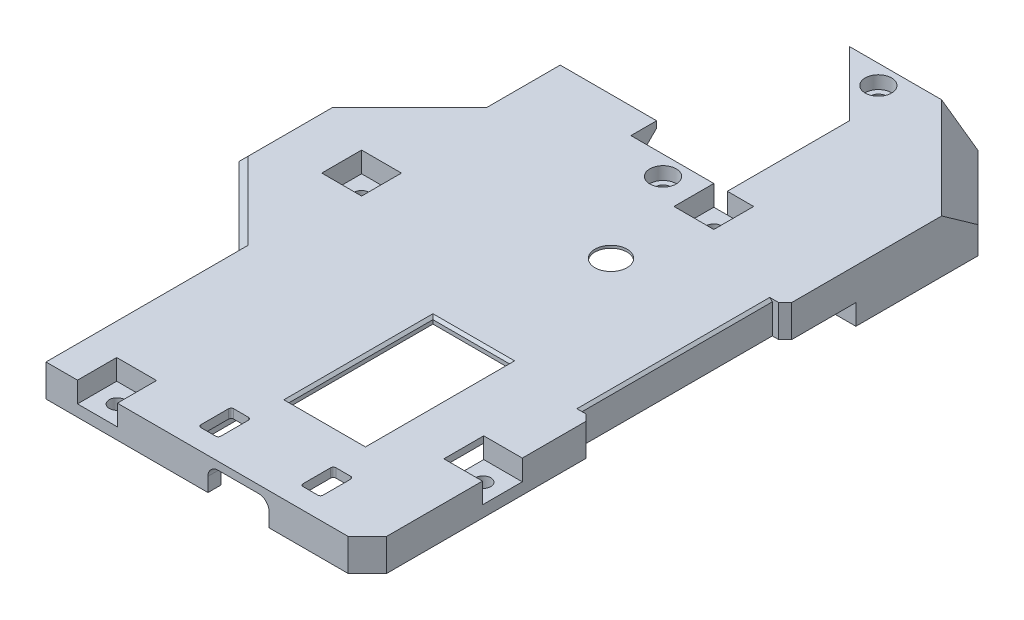
from build123d import *

# Parameters (mm, degrees)
EXTRUDE_1_DEPTH          = 5
CUT_EXTRUDE_1_DEPTH      = 117.404467268
CUT_EXTRUDE_1_DEPTH_BACK = 117.404467268
EXTRUDE_2_DEPTH          = 2
EXTRUDE_3_DEPTH          = 3
CHAMFER_1_SIZE           = 3
CHAMFER_2_SIZE           = 4
EXTRUDE_4_DEPTH          = 5
CHAMFER_3_SIZE           = 4
SKETCH_6_R               = 2.05
CUT_EXTRUDE_2_DEPTH      = 2
SKETCH_7_R               = 1.2
CUT_EXTRUDE_3_DEPTH      = 3
CHAMFER_4_SIZE           = 1
CHAMFER_5_SIZE           = 3
SKETCH_8_W               = 2
SKETCH_8_H               = 30
CUT_EXTRUDE_4_DEPTH      = 117.404467268
SKETCH_9_W               = 28.1
SKETCH_9_H               = 63.9
CUT_EXTRUDE_5_DEPTH      = 0.6
CUT_EXTRUDE_6_DEPTH      = 3.4
CUT_EXTRUDE_7_REACH      = 118.404
SKETCH_12_W              = 20.3
SKETCH_12_H              = 20.1
CUT_EXTRUDE_8_DEPTH      = 0.6
SKETCH_13_W              = 11.9
SKETCH_13_H              = 22.4
CUT_EXTRUDE_9_DEPTH      = 1
SKETCH_14_R              = 2.5
CUT_EXTRUDE_10_DEPTH     = 117.387971887
CHAMFER_6_SIZE           = 0.4
SKETCH_15_W              = 20.3
SKETCH_15_H              = 2
CUT_EXTRUDE_11_DEPTH     = 4.6
SKETCH_16_W              = 6.2
SKETCH_16_H              = 6.1
SKETCH_16_W_2            = 6
SKETCH_16_H_2            = 6.2
CUT_EXTRUDE_12_DEPTH     = 3.2
SKETCH_17_R              = 1.2
CUT_EXTRUDE_13_DEPTH     = 117.341050365
SKETCH_18_R              = 1.2
CUT_EXTRUDE_14_DEPTH     = 117.404467268
SKETCH_19_R              = 2.05
CUT_EXTRUDE_15_DEPTH     = 2
EXTRUDE_5_DEPTH          = 15
CHAMFER_8_SIZE           = 1
EXTRUDE_6_DEPTH          = 1.2
CHAMFER_9_SIZE           = 1.2
FILLET_START             = -55.913222165
FILLET_2_DEPTH           = 11.82644433
FILLET_2_2_ANGLE         = 180
FILLET_2_3_ANGLE         = 180
SKETCH_23_W              = 3.9
SKETCH_23_H              = 22
CUT_EXTRUDE_16_DEPTH     = 3
CHAMFER_10_SIZE          = 3
CUT_EXTRUDE_17_REACH     = 118.404
SKETCH_24_W              = 3.1
SKETCH_24_H              = 5.1
SKETCH_25_W              = 5.5
SKETCH_25_H              = 7.5
SKETCH_25_W_2            = 3.1
SKETCH_25_H_2            = 5.1
EXTRUDE_7_DEPTH          = 0.4
FILLET_3_R               = 0.4
EXTRUDE_8_DEPTH          = 3.2
CUT_EXTRUDE_18_DEPTH     = 2.2
CUT_EXTRUDE_19_DEPTH     = 0.4
CUT_EXTRUDE_20_DEPTH     = 0.4
FILLET_4_R               = 0.4
CHAMFER_11_SIZE          = 0.4


with BuildPart() as part:
    # 草图1 → 凸台-拉伸1 (new body)
    with BuildSketch(Plane(origin=(0, 0, 0), x_dir=(1, 0, 0), z_dir=(0, 1, 0))):
        Polygon((40, 105), (50, 95), (50, 0), (0, 0), (0, 105), align=None)
    extrude(amount=EXTRUDE_1_DEPTH)

    # 草图2 → 切除-拉伸1 (cut, two sides: drawn at the far end of the back side and taken through both)
    with BuildSketch(Plane(origin=(0, 5, 0), x_dir=(1, 0, 0), z_dir=(0, 1, 0)).offset(-CUT_EXTRUDE_1_DEPTH_BACK)):
        Polygon((0, 105), (20, 105), (30, 95), (30, 76), (0, 76), align=None)
    extrude(amount=CUT_EXTRUDE_1_DEPTH + CUT_EXTRUDE_1_DEPTH_BACK, mode=Mode.SUBTRACT)

    # 草图3 → 凸台-拉伸2 (add)
    with BuildSketch(Plane(origin=(0, 5, 0), x_dir=(1, 0, 0), z_dir=(0, 1, 0))):
        Polygon((0, 70), (0, 30), (-13, 43), (-13, 57), align=None)
    extrude(amount=-EXTRUDE_2_DEPTH)

    # 草图4 → 凸台-拉伸3 (add)
    with BuildSketch(Plane.XZ.offset(-3)):
        Polygon((0, -70), (-4, -66), (-4, -34), (0, -30), align=None)
    extrude(amount=EXTRUDE_3_DEPTH)

    # 倒角1
    chamfer_1_edges = [part.edges().sort_by_distance(p)[0] for p in [
        (-4, 3, -50),
    ]]
    chamfer(chamfer_1_edges, length=CHAMFER_1_SIZE - 0.0001)  # a hair under: the kernel refuses the full size

    # 倒角2
    chamfer_2_edges = [part.edges().sort_by_distance(p)[0] for p in [
        (45, 5, -100),
    ]]
    chamfer(chamfer_2_edges, length=CHAMFER_2_SIZE)

    # 草图5 → 凸台-拉伸4 (add)
    with BuildSketch(Plane(origin=(0, 5, 0), x_dir=(1, 0, 0), z_dir=(0, 1, 0))):
        Polygon((0, 0), (-4, 4), (-4, 16), (0, 20), align=None)
    extrude(amount=-EXTRUDE_4_DEPTH)

    # 倒角3
    chamfer_3_edges = [part.edges().sort_by_distance(p)[0] for p in [
        (-4, 5, -10),
    ]]
    chamfer(chamfer_3_edges, length=CHAMFER_3_SIZE)

    # 草图6 → 切除-拉伸2 (cut)
    with BuildSketch(Plane(origin=(0, 5, 0), x_dir=(1, 0, 0), z_dir=(0, 1, 0))):
        with Locations(Location((27.5, 102, 0), (0, 0, 270))):
            Circle(SKETCH_6_R)
    extrude(amount=-CUT_EXTRUDE_2_DEPTH, mode=Mode.SUBTRACT)

    # 草图7 → 切除-拉伸3 (cut)
    with BuildSketch(Plane(origin=(0, 3, 0), x_dir=(1, 0, 0), z_dir=(0, 1, 0))):
        with Locations(Location((27.5, 102, 0), (0, 0, 270))):
            Circle(SKETCH_7_R)
    extrude(amount=-CUT_EXTRUDE_3_DEPTH, mode=Mode.SUBTRACT)

    # 倒角4
    chamfer_4_edges = [part.edges().sort_by_distance(p)[0] for p in [
        (-6.5, 5, -63.5),
        (-13, 5, -50),
        (-6.5, 5, -36.5),
    ]]
    chamfer(chamfer_4_edges, length=CHAMFER_4_SIZE)

    # 倒角5
    chamfer_5_edges = [part.edges().sort_by_distance(p)[0] for p in [
        (50, 2.5, 0),
    ]]
    chamfer(chamfer_5_edges, length=CHAMFER_5_SIZE)

    # 草图8 → 切除-拉伸4 (cut, through all)
    with BuildSketch(Plane(origin=(0, 5, 0), x_dir=(1, 0, 0), z_dir=(0, 1, 0))):
        with Locations((49, 50)):
            Rectangle(SKETCH_8_W, SKETCH_8_H)
    extrude(amount=-CUT_EXTRUDE_4_DEPTH, mode=Mode.SUBTRACT)

    # 草图9 → 切除-拉伸5 (cut)
    with BuildSketch(Plane.XZ):
        with Locations((29.95, -33.95)):
            Rectangle(SKETCH_9_W, SKETCH_9_H)
    extrude(amount=-CUT_EXTRUDE_5_DEPTH, mode=Mode.SUBTRACT)

    # 草图10 → 切除-拉伸6 (cut)
    with BuildSketch(Plane.XZ.offset(-0.6)):
        Polygon((18.3, -65.9), (18.3, -27), (15.9, -27), (15.9, -20), (18.3, -20), (18.3, -2), (41.6, -2), (41.6, -6), (44, -6), (44, -65.9), (41.6, -65.9), align=None)
    extrude(amount=-CUT_EXTRUDE_6_DEPTH, mode=Mode.SUBTRACT)

    # 草图11 → 切除-拉伸7 (cut, up to next)
    with BuildSketch(Plane.XY, mode=Mode.PRIVATE) as cut_extrude_7_sk1:
        with BuildLine():
            Line((25.2, 0), (34.7, 0))
            Line((34.7, 0), (34.7, 2.2))
            ThreePointArc((34.7, 2.2), (34.23137085, 3.33137085), (33.1, 3.8))
            Line((33.1, 3.8), (26.8, 3.8))
            ThreePointArc((26.8, 3.8), (25.66862915, 3.33137085), (25.2, 2.2))
            Line((25.2, 2.2), (25.2, 0))
        make_face()
    cut_extrude_7_tool1 = extrude(cut_extrude_7_sk1.sketch, amount=-CUT_EXTRUDE_7_REACH, mode=Mode.PRIVATE) & part.part
    add(cut_extrude_7_tool1.solids().sort_by_distance((29.95, 1.851574, 0))[0], mode=Mode.SUBTRACT)

    # 草图12 → 切除-拉伸8 (cut)
    with BuildSketch(Plane.XZ.offset(-4)):
        with Locations((29.95, -55.85)):
            Rectangle(SKETCH_12_W, SKETCH_12_H)
    extrude(amount=-CUT_EXTRUDE_8_DEPTH, mode=Mode.SUBTRACT)

    # 草图13 → 切除-拉伸9 (cut)
    with BuildSketch(Plane.XZ.offset(-4)):
        with Locations((29.95, -25)):
            Rectangle(SKETCH_13_W, SKETCH_13_H)
    extrude(amount=-CUT_EXTRUDE_9_DEPTH, mode=Mode.SUBTRACT)

    # 草图14 → 切除-拉伸10 (cut, through all)
    with BuildSketch(Plane.XZ.offset(-4.6)):
        with Locations(Location((30, -57.9, 0), (0, 0, 270))):
            Circle(SKETCH_14_R)
    extrude(amount=-CUT_EXTRUDE_10_DEPTH, mode=Mode.SUBTRACT)

    # 倒角6
    chamfer_6_edges = [part.edges().sort_by_distance(p)[0] for p in [
        (24, 5, -25),
        (29.95, 5, -13.8),
        (35.9, 5, -25),
        (29.95, 5, -36.2),
    ]]
    chamfer(chamfer_6_edges, length=CHAMFER_6_SIZE)

    # 草图15 → 切除-拉伸11 (cut)
    with BuildSketch(Plane.XZ):
        with Locations((29.95, -66.9)):
            Rectangle(SKETCH_15_W, SKETCH_15_H)
    extrude(amount=-CUT_EXTRUDE_11_DEPTH, mode=Mode.SUBTRACT)

    # 草图16 → 切除-拉伸12 (cut)
    with BuildSketch(Plane(origin=(0, 5, 0), x_dir=(1, 0, 0), z_dir=(0, 1, 0))):
        with Locations((8, 3.05)):
            Rectangle(SKETCH_16_W, SKETCH_16_H)
        with Locations((47, 21)):
            Rectangle(SKETCH_16_W_2, SKETCH_16_H_2)
        with Locations((31, 72.9)):
            Rectangle(SKETCH_16_W, SKETCH_16_H_2)
        with Locations((-0.9, 50)):
            Rectangle(SKETCH_16_W, SKETCH_16_H_2)
    extrude(amount=-CUT_EXTRUDE_12_DEPTH, mode=Mode.SUBTRACT)

    # 草图17 → 切除-拉伸13 (cut, through all)
    with BuildSketch(Plane(origin=(0, 1.8, 0), x_dir=(1, 0, 0), z_dir=(0, 1, 0))):
        with Locations(Location((31, 72.9, 0), (0, 0, 270))):
            Circle(SKETCH_17_R)
        with Locations(Location((47, 21, 0), (0, 0, 270))):
            Circle(SKETCH_17_R)
        with Locations(Location((-0.9, 50, 0), (0, 0, 270))):
            Circle(SKETCH_17_R)
        with Locations(Location((8, 3.05, 0), (0, 0, 270))):
            Circle(SKETCH_17_R)
    extrude(amount=-CUT_EXTRUDE_13_DEPTH, mode=Mode.SUBTRACT)

    # 草图18 → 切除-拉伸14 (cut, through all)
    with BuildSketch(Plane.XZ):
        with Locations(Location((23, -73, 0), (0, 0, 270))):
            Circle(SKETCH_18_R)
    extrude(amount=-CUT_EXTRUDE_14_DEPTH, mode=Mode.SUBTRACT)

    # 草图19 → 切除-拉伸15 (cut)
    with BuildSketch(Plane(origin=(0, 5, 0), x_dir=(1, 0, 0), z_dir=(0, 1, 0))):
        with Locations(Location((23, 73, 0), (0, 0, 270))):
            Circle(SKETCH_19_R)
    extrude(amount=-CUT_EXTRUDE_15_DEPTH, mode=Mode.SUBTRACT)

    # 草图21 → 凸台-拉伸5 (add)
    with BuildSketch(Plane.ZY):
        Polygon((-76, 0), (-76, 5), (-80, 5), (-80, 4), align=None)
    extrude(amount=-EXTRUDE_5_DEPTH)

    # 倒角8
    chamfer_8_edges = [part.edges().sort_by_distance(p)[0] for p in [
        (50, 2.5, -65),
        (50, 2.5, -35),
    ]]
    chamfer(chamfer_8_edges, length=CHAMFER_8_SIZE)

    # 草图22 → 凸台-拉伸6 (add)
    with BuildSketch(Plane.XZ.offset(-3)):
        with BuildLine():
            Line((-10.2, -45), (-10.2, -55))
            ThreePointArc((-10.2, -55), (-11, -55.8), (-11.8, -55))
            Line((-11.8, -55), (-11.8, -45))
            ThreePointArc((-11.8, -45), (-11, -44.2), (-10.2, -45))
        make_face()
    extrude(amount=EXTRUDE_6_DEPTH)

    # 倒角9
    chamfer_9_edges = [part.edges().sort_by_distance(p)[0] for p in [
        (-10.2, 3, -50),
        (-11, 3, -44.2),
        (-11, 3, -55.8),
        (-11.8, 3, -50),
    ]]
    chamfer(chamfer_9_edges, length=CHAMFER_9_SIZE - 0.0001)  # a hair under: the kernel refuses the full size

    # 圆角2: read off the stored shape, not the designer's step
    # 圆角2 outline → 圆角2 (cut)
    with BuildSketch(Plane.XY.offset(FILLET_START)):
        with BuildLine():
            Line((-11.8, 1.8), (-11.385786438, 1.8))
            ThreePointArc((-11.385786438, 1.8), (-11.76846987, 1.876120467), (-12.092893219, 2.092893219))
            Line((-12.092893219, 2.092893219), (-11.8, 1.8))
        make_face()
        with BuildLine():
            ThreePointArc((-9.907106781, 2.092893219), (-10.23153013, 1.876120467), (-10.614213562, 1.8))
            Line((-10.614213562, 1.8), (-10.2, 1.8))
            Line((-10.2, 1.8), (-9.907106781, 2.092893219))
        make_face()
    extrude(amount=FILLET_2_DEPTH, mode=Mode.SUBTRACT)

    # Fillet 2 2 outline → Fillet 2 2 (revolve, cut)
    with BuildSketch(Plane(origin=(-11, 0, -55), x_dir=(1, 0, 0), z_dir=(0, 0, 1))):
        with BuildLine():
            Line((1.092893219, 1.8), (1.092893219, 2.092893219))
            ThreePointArc((1.092893219, 2.092893219), (0.76846987, 1.876120467), (0.385786438, 1.8))
            Line((0.385786438, 1.8), (1.092893219, 1.8))
        make_face()
    revolve(axis=Axis((-11, 0, -55), (0, 1, 0)), revolution_arc=FILLET_2_2_ANGLE, mode=Mode.SUBTRACT)

    # Fillet 2 3 outline → Fillet 2 3 (revolve, cut)
    with BuildSketch(Plane(origin=(-11, 0, -45), x_dir=(-1, 0, 0), z_dir=(0, 0, -1))):
        with BuildLine():
            Line((1.092893219, 1.8), (1.092893219, 2.092893219))
            ThreePointArc((1.092893219, 2.092893219), (0.76846987, 1.876120467), (0.385786438, 1.8))
            Line((0.385786438, 1.8), (1.092893219, 1.8))
        make_face()
    revolve(axis=Axis((-11, 0, -45), (0, 1, 0)), revolution_arc=FILLET_2_3_ANGLE, mode=Mode.SUBTRACT)

    # 草图23 → 切除-拉伸16 (cut)
    with BuildSketch(Plane.XZ):
        with Locations((42.05, -76.9)):
            Rectangle(SKETCH_23_W, SKETCH_23_H)
    extrude(amount=-CUT_EXTRUDE_16_DEPTH, mode=Mode.SUBTRACT)

    # 倒角10
    chamfer_10_edges = [part.edges().sort_by_distance(p)[0] for p in [
        (42.05, 3, -87.9),
    ]]
    chamfer(chamfer_10_edges, length=CHAMFER_10_SIZE - 0.0001)  # a hair under: the kernel refuses the full size

    # 草图24 → 切除-拉伸17 (cut, up to next)
    with BuildSketch(Plane(origin=(0, 5, 0), x_dir=(1, 0, 0), z_dir=(0, 1, 0)), mode=Mode.PRIVATE) as cut_extrude_17_sk1:
        with Locations((22.050353573, 5.75)):
            Rectangle(SKETCH_24_W, SKETCH_24_H)
    cut_extrude_17_tool1 = extrude(cut_extrude_17_sk1.sketch, amount=-CUT_EXTRUDE_17_REACH, mode=Mode.PRIVATE) & part.part
    # 草图24 → 切除-拉伸17 (cut, up to next)
    with BuildSketch(Plane(origin=(0, 5, 0), x_dir=(1, 0, 0), z_dir=(0, 1, 0)), mode=Mode.PRIVATE) as cut_extrude_17_sk2:
        with Locations((37.947463912, 5.75)):
            Rectangle(SKETCH_24_W, SKETCH_24_H)
    cut_extrude_17_tool2 = extrude(cut_extrude_17_sk2.sketch, amount=-CUT_EXTRUDE_17_REACH, mode=Mode.PRIVATE) & part.part
    add(cut_extrude_17_tool1.solids().sort_by_distance((22.050354, 5, -5.75))[0], mode=Mode.SUBTRACT)
    add(cut_extrude_17_tool2.solids().sort_by_distance((37.947464, 5, -5.75))[0], mode=Mode.SUBTRACT)

    # 草图25 → 凸台-拉伸7 (add)
    # profile 1 of 2: a face of its own
    with BuildSketch(Plane.XZ.offset(-4)):
        with Locations((37.947463912, -5.75)):
            Rectangle(SKETCH_25_W, SKETCH_25_H)
        with Locations((37.947463912, -5.75)):
            Rectangle(SKETCH_25_W_2, SKETCH_25_H_2, mode=Mode.SUBTRACT)
    # profile 2 of 2: a face of its own
    with BuildSketch(Plane.XZ.offset(-4)):
        with Locations((22.050353573, -5.75)):
            Rectangle(SKETCH_25_W, SKETCH_25_H)
        with Locations((22.050353573, -5.75)):
            Rectangle(SKETCH_25_W_2, SKETCH_25_H_2, mode=Mode.SUBTRACT)
    extrude(amount=EXTRUDE_7_DEPTH)

    # 圆角3
    fillet_3_edges = [part.edges().sort_by_distance(p)[0] for p in [
        (20.500353573, 4.3, -3.2),
        (20.500353573, 4.3, -8.3),
        (23.600353573, 4.3, -8.3),
        (23.600353573, 4.3, -3.2),
        (36.397463912, 4.3, -3.2),
        (36.397463912, 4.3, -8.3),
        (39.497463912, 4.3, -8.3),
        (39.497463912, 4.3, -3.2),
    ]]
    fillet(fillet_3_edges, radius=FILLET_3_R)

    # 草图26 → 凸台-拉伸8 (add)
    with BuildSketch(Plane.XZ):
        Polygon((50, -76), (50, -95), (40, -105), (30, -105), (30, -99), (34.686291501, -99), (44, -89.686291501), (44, -76), align=None)
    extrude(amount=EXTRUDE_8_DEPTH)

    # 草图27 → 切除-拉伸18 (cut)
    with BuildSketch(Plane.XZ.offset(3.2)):
        Polygon((41.2, -103.8), (48.8, -96.2), (48.8, -92.731007831), (46.291855398, -90.222863228), (44.736220479, -91.778498147), (45.44332726, -92.485604928), (44.877641835, -93.051290353), (44.170535054, -92.344183572), (37.344183572, -99.170535054), (38.051290353, -99.877641835), (37.485604928, -100.44332726), (36.778498147, -99.736220479), (35.222863228, -101.291855398), (37.731007831, -103.8), align=None)
    extrude(amount=-CUT_EXTRUDE_18_DEPTH, mode=Mode.SUBTRACT)

    # 草图29 → 切除-拉伸19 (cut)
    with BuildSketch(Plane.XZ.offset(1)):
        Polygon((39.286577208, -97.228141418), (42.228141418, -94.286577208), (44.915147186, -96.973582977), (41.973582977, -99.915147186), align=None)
    extrude(amount=-CUT_EXTRUDE_19_DEPTH, mode=Mode.SUBTRACT)

    # 草图30 → 切除-拉伸20 (cut)
    with BuildSketch(Plane.XZ.offset(3.2)):
        Polygon((37.344183572, -99.170535054), (44.170535054, -92.344183572), (42.756321492, -90.929970009), (35.929970009, -97.756321492), align=None)
    extrude(amount=-CUT_EXTRUDE_20_DEPTH, mode=Mode.SUBTRACT)

    # 圆角4
    fillet_4_edges = [part.edges().sort_by_distance(p)[0] for p in [
        (48.8, -2.1, -96.2),
        (41.2, -2.1, -103.8),
    ]]
    fillet(fillet_4_edges, radius=FILLET_4_R)

    # 倒角11
    chamfer_11_edges = [part.edges().sort_by_distance(p)[0] for p in [
        (48, 5, -50),
    ]]
    chamfer(chamfer_11_edges, length=CHAMFER_11_SIZE)


solid = part.part
